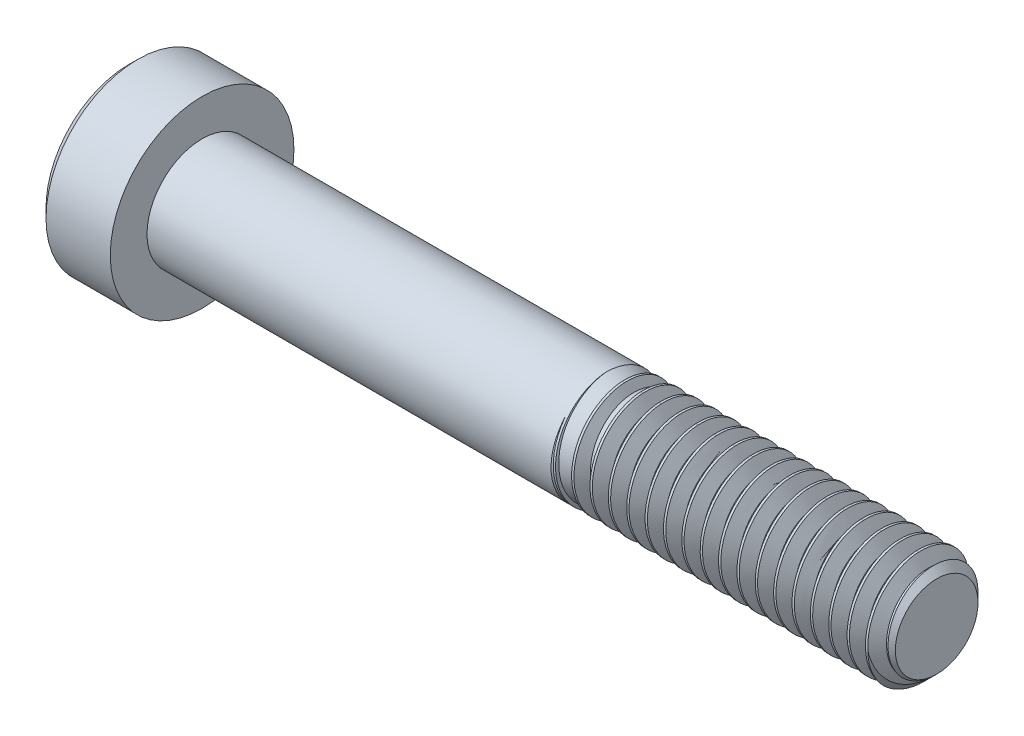
from build123d import *

# Parameters (mm, degrees)
SKETCH2_R           = 3
BOSS_EXTRUDE1_DEPTH = 18
CHAMFER1_SIZE       = 0.75
CUT_EXTRUDE1_DEPTH  = 3.12
CUT_SWEEP1_PITCH    = 1
CUT_SWEEP1_TO       = 18


with BuildPart() as part:
    # Sketch2 → Boss-Extrude1 (new body)
    with BuildSketch(Plane(origin=(20, 0, 0), x_dir=(0, 0, -1), z_dir=(1, 0, 0))):
        Circle(SKETCH2_R)
    extrude(amount=-BOSS_EXTRUDE1_DEPTH)

    # Chamfer1
    chamfer1_edges = [part.edges().sort_by_distance(p)[0] for p in [
        (20, 0, 3),
    ]]
    chamfer(chamfer1_edges, length=CHAMFER1_SIZE)

    # Sketch10 → Revolve2 (revolve)
    with BuildSketch(Plane.XY, mode=Mode.PRIVATE) as revolve2_sk:
        Polygon((3.732050808, 0), (2, 3), (-20, 3), (-20, 0), align=None)
    revolve(revolve2_sk.sketch.rotate(Axis((-20, 0, 0), (1, 0, 0)), 270), axis=Axis((-20, 0, 0), (1, 0, 0)))

    # Sketch6 → Revolve1 (revolve)
    with BuildSketch(Plane.XY):
        Polygon((-23.5, 5), (-24, 4.5), (-24, 0), (-20, 0), (-20, 5), align=None)
    revolve(axis=Axis((-20, 0, 0), (-1, 0, 0)))

    # Sketch4 → Cut-Extrude1 (cut)
    with BuildSketch(Plane(origin=(-24, 0, 0), x_dir=(0, 0, -1), z_dir=(1, 0, 0))):
        Polygon((0, 2.309401077), (-2, 1.154700538), (-2, -1.154700538), (0, -2.309401077), (2, -1.154700538), (2, 1.154700538), align=None)
    extrude(amount=CUT_EXTRUDE1_DEPTH, mode=Mode.SUBTRACT)

    # Cut-Extrude2 cone 1 section (through the dimple's axis) → Cut-Extrude2 (revolve, cut)
    with BuildSketch(Plane(origin=(-24, 0, 0), x_dir=(0, 0, 1), z_dir=(0, 1, 0))):
        Polygon((0, 0), (2.309401077, 0), (0, 2.309401077), align=None)
    revolve(axis=Axis((-24, 0, 0), (1, 0, 0)), mode=Mode.SUBTRACT)


with BuildPart() as body_2:
    # Split1: the piece on the far side of the plane
    add(part.part)
    split(bisect_by=Plane(origin=(2, 3, 0), x_dir=(0, 0, -1), z_dir=(-1, 0, 0)), keep=Keep.BOTTOM)

    # Cut-Sweep1: arcs per turn and ends read off the stored shape
    # Cut-Sweep1: the profile of Sketch5 screwed along a right-hand helix through 19 turns, 8 arcs to a turn; built about Z, then put on its axis
    cut_sweep1_z = Axis((0, 0, 0), (0, 0, 1))
    cut_sweep1_corners = [(3.054126588, 0, 0.03125), (3.054126588, 0, -0.90625), (2.350480947, 0, -0.5), (2.350480947, 0, -0.375)]
    with BuildLine(mode=Mode.PRIVATE) as cut_sweep1_profile:
        Line(cut_sweep1_corners[0], cut_sweep1_corners[1])
        Line(cut_sweep1_corners[1], cut_sweep1_corners[2])
        Line(cut_sweep1_corners[2], cut_sweep1_corners[3])
        Line(cut_sweep1_corners[3], cut_sweep1_corners[0])
    cut_sweep1_cap = Face(cut_sweep1_profile.wire())
    cut_sweep1_turn_angles = [0, 22.5, 45, 67.5, 90, 112.5, 135, 157.5, 180, 202.5, 225, 247.5, 270, 292.5, 315, 337.5, 360]
    cut_sweep1_turn_weights = [1, 0.9238795325112867, 1, 0.9238795325112867, 1, 0.9238795325112867, 1, 0.9238795325112867, 1, 0.9238795325112867, 1, 0.9238795325112867, 1, 0.9238795325112867, 1, 0.9238795325112867, 1]
    cut_sweep1_turn_rails = [Edge.make_bspline([Vector(p[0], p[1], 0).rotate(cut_sweep1_z, cut_sweep1_turn_angles[k]) / cut_sweep1_turn_weights[k] + Vector(0, 0, p[2] + CUT_SWEEP1_PITCH * cut_sweep1_turn_angles[k] / 360) for k in range(17)], [0, 0, 0, 1, 1, 2, 2, 3, 3, 4, 4, 5, 5, 6, 6, 7, 7, 8, 8, 8], 2, cut_sweep1_turn_weights) for p in cut_sweep1_corners]
    cut_sweep1_turn_sides = [Face.make_surface_from_curves(cut_sweep1_turn_rails[p[0]], cut_sweep1_turn_rails[p[1]]) for p in [(0, 1), (1, 2), (2, 3), (3, 0)]]
    cut_sweep1 = Plane(origin=(20, 0, 0), x_dir=(0, 1, 0), z_dir=(-1, 0, 0)) * split(Solid(Shell([*[p.moved(Location((0, 0, CUT_SWEEP1_PITCH * i))) for i in range(19) for p in cut_sweep1_turn_sides], cut_sweep1_cap, cut_sweep1_cap.rotate(cut_sweep1_z, 6840).moved(Location((0, 0, CUT_SWEEP1_PITCH * 6840 / 360)))])), bisect_by=Plane.XY.offset(CUT_SWEEP1_TO), keep=Keep.BOTTOM, mode=Mode.PRIVATE)
    add(cut_sweep1, mode=Mode.SUBTRACT)


with BuildPart() as part_1:
    add(part.part)

    # Split1
    split(bisect_by=Plane(origin=(2, 3, 0), x_dir=(0, 0, -1), z_dir=(-1, 0, 0)), keep=Keep.TOP)

    add(body_2.part)  # Boss-Extrude2 merges body 2
    # Boss-Extrude2 cone 1 section (through the dimple's axis) → Boss-Extrude2 (revolve)
    with BuildSketch(Plane(origin=(2, 0, 0), x_dir=(0, 0, 1), z_dir=(0, 1, 0))):
        Polygon((0, 0), (3, 0), (0, 8.242432258), align=None)
    revolve(axis=Axis((2, 0, 0), (1, 0, 0)))


solid = part_1.part
